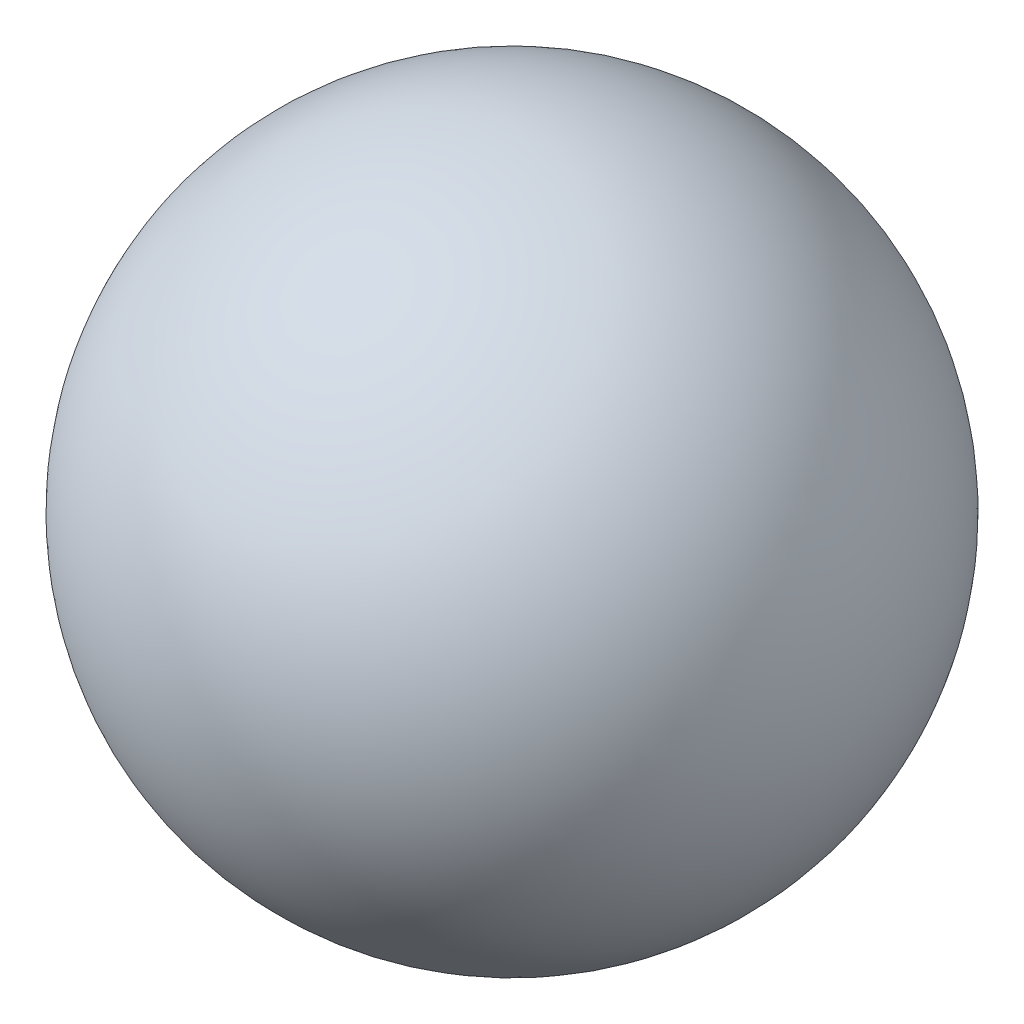
from build123d import *

# Parameters (mm, degrees)
SHELL1_T = 3.175


with BuildPart() as part:
    # Sketch1 → Revolve6 (revolve)
    with BuildSketch(Plane(origin=(0, 0, 0), x_dir=(1, 0, 0), z_dir=(0, 1, 0))):
        with BuildLine():
            Line((-274.32, 0), (274.32, 0))
            ThreePointArc((274.32, 0), (0, 274.32), (-274.32, 0))
        make_face()
    revolve(axis=Axis((-274.32, 0, 0), (1, 0, 0)))

    # Shell1 (no face opened: a closed hollow body)
    add(offset(amount=-SHELL1_T, mode=Mode.PRIVATE), mode=Mode.SUBTRACT)


solid = part.part
